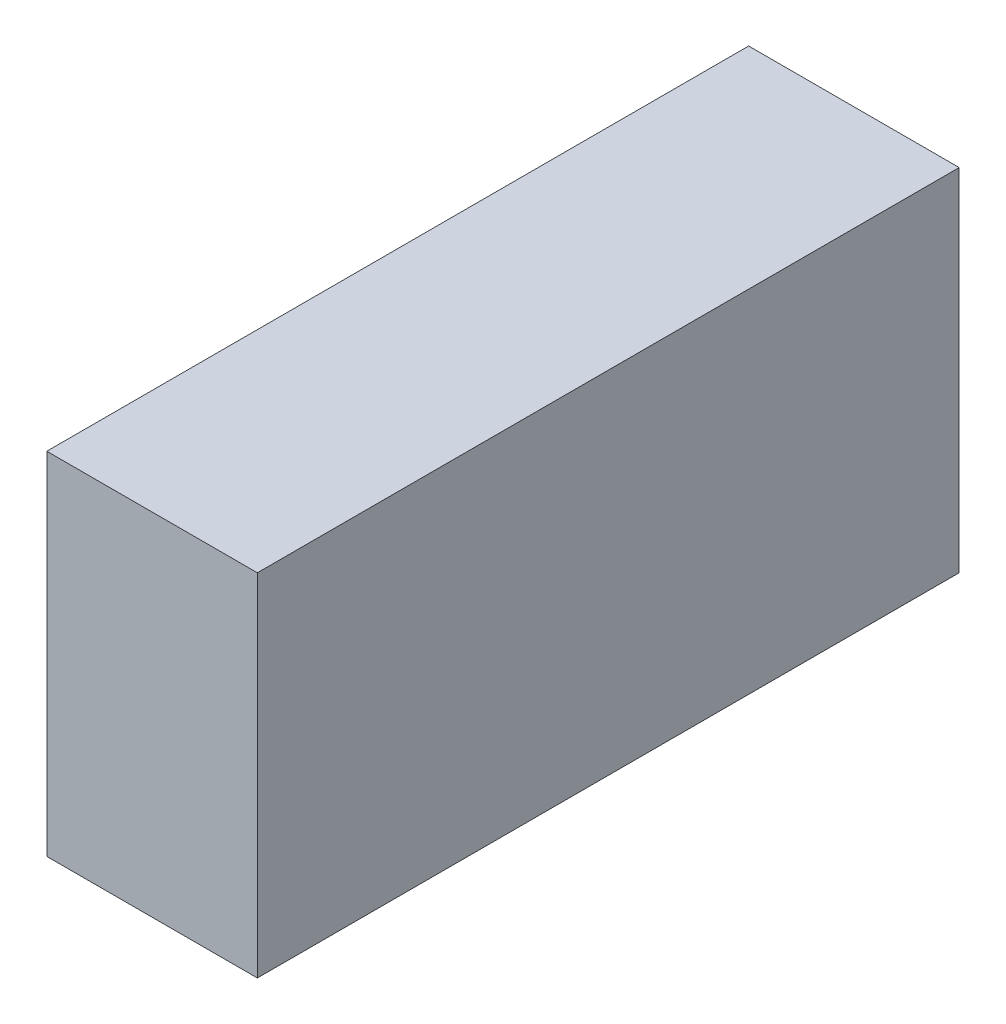
from build123d import *

# Parameters (mm, degrees)
SRECTANGLE_W     = 3
SRECTANGLE_H     = 10
FRECTANGLE_DEPTH = 5


with BuildPart() as part:
    # SRectangle → FRectangle (new body)
    with BuildSketch(Plane(origin=(0, 0, 0), x_dir=(1, 0, 0), z_dir=(0, 1, 0))):
        Rectangle(SRECTANGLE_W, SRECTANGLE_H)
    extrude(amount=-FRECTANGLE_DEPTH)


solid = part.part
